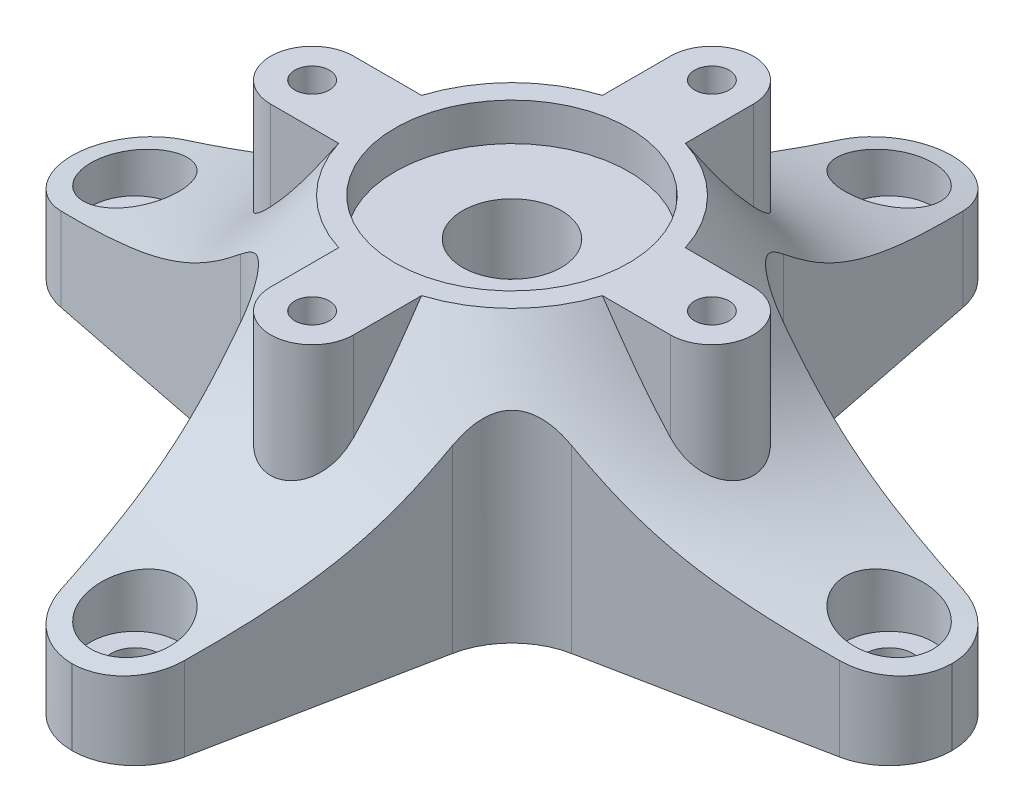
from build123d import *

# Parameters (mm, degrees)
SKETCH2_R                    = 27.94
SKETCH1_R                    = 88.9
CUT_EXTRUDE1_DEPTH           = 132.187065933
FILLET1_R                    = 15.24
BOSS_EXTRUDE1_START          = 15.24
BOSS_EXTRUDE1_DEPTH          = 15.24
BOSS_EXTRUDE2_START          = -24.628436
SKETCH11_R                   = 23.8125
BOSS_EXTRUDE2_DEPTH          = 24.628436
SKETCH12_R                   = 23.622
CUT_EXTRUDE3_DEPTH           = 7.62
SKETCH13_R                   = 22.5425
SKETCH13_R_2                 = 17.4625
BOSS_EXTRUDE3_DEPTH          = 7.62
SKETCH14_R                   = 9.9695
CUT_EXTRUDE4_DEPTH           = 13.97
SKETCH15_R                   = 7.366
CUT_EXTRUDE5_DEPTH           = 13.97
SKETCH17_R                   = 9.9695
SKETCH16_R                   = 7.366
U_0_368_DIAMETER_HOLE2_D     = 6.985
U_0_368_DIAMETER_HOLE2_DEPTH = 25.4
U_0_368_DIAMETER_HOLE2_TIP   = 2.098505712
SKETCH27_R                   = 4.826
CUT_EXTRUDE6_DEPTH           = 137.32401502
CUT_EXTRUDE7_START           = -44.45
CUT_EXTRUDE7_OUTLINE_R       = 8.89
CUT_EXTRUDE7_OUTLINE_R_2     = 4.826
CUT_EXTRUDE7_DEPTH           = 11.491512278
CIRPATTERN1_COUNT            = 4


# Read off the part's stored shape, not the designer's step: Cut-Extrude7
with BuildPart() as part:
    # Sketch2 → Loft1 section 0
    with BuildSketch(Plane(origin=(0, 37.465, 0), x_dir=(1, 0, 0), z_dir=(0, 1, 0))):
        Circle(SKETCH2_R)
    # Sketch1 → Loft1 section 1
    with BuildSketch(Plane(origin=(0, 0, 0), x_dir=(1, 0, 0), z_dir=(0, 1, 0))):
        Circle(SKETCH1_R)
    loft()

    # Sketch4 → Cut-Revolve1 (revolve, cut)
    with BuildSketch(Plane.XY):
        with BuildLine():
            Line((27.94, 37.465), (88.9, 0))
            add(Edge.make_bspline(
                [(27.94, 37.465), (44.244603089, 12.498594915), (51.492919323, 6.107575084), (88.9, 0)],
                knots=[0, 0, 0, 0, 1, 1, 1, 1], degree=3))
        make_face()
    revolve(axis=Axis((0, 0, 0), (0, 1, 0)), mode=Mode.SUBTRACT)

    # Sketch5 → Cut-Extrude1 (cut, through all)
    with BuildSketch(Plane.XZ):
        with BuildLine():
            Line((78.673834774, -12.456807136), (23.426780231, -23.426780231))
            Line((23.426780231, -23.426780231), (12.456807136, -78.673834774))
            ThreePointArc((12.456807136, -78.673834774), (8.099631088, -85.982305442), (0.106749312, -88.899935909))
            ThreePointArc((0.106749312, -88.899935909), (62.861792847, -62.861792847), (88.899935909, -0.106749312))
            ThreePointArc((88.899935909, -0.106749312), (85.982305442, -8.099631088), (78.673834774, -12.456807136))
        make_face()
        with BuildLine():
            ThreePointArc((-88.899935909, -0.106749312), (-62.861792847, -62.861792847), (-0.106749312, -88.899935909))
            ThreePointArc((-0.106749312, -88.899935909), (-8.099631088, -85.982305442), (-12.456807136, -78.673834774))
            Line((-12.456807136, -78.673834774), (-23.426780231, -23.426780231))
            Line((-23.426780231, -23.426780231), (-78.673834774, -12.456807136))
            ThreePointArc((-78.673834774, -12.456807136), (-85.982305442, -8.099631088), (-88.899935909, -0.106749312))
        make_face()
        with BuildLine():
            ThreePointArc((-12.456807136, 78.673834774), (-8.099631088, 85.982305442), (-0.106749312, 88.899935909))
            ThreePointArc((-0.106749312, 88.899935909), (-62.861792847, 62.861792847), (-88.899935909, 0.106749312))
            ThreePointArc((-88.899935909, 0.106749312), (-85.982305442, 8.099631088), (-78.673834774, 12.456807136))
            Line((-78.673834774, 12.456807136), (-23.426780231, 23.426780231))
            Line((-23.426780231, 23.426780231), (-12.456807136, 78.673834774))
        make_face()
        with BuildLine():
            ThreePointArc((78.673834774, 12.456807136), (85.982305442, 8.099631088), (88.899935909, 0.106749312))
            ThreePointArc((88.899935909, 0.106749312), (62.861792847, 62.861792847), (0.106749312, 88.899935909))
            ThreePointArc((0.106749312, 88.899935909), (8.099631088, 85.982305442), (12.456807136, 78.673834774))
            Line((12.456807136, 78.673834774), (23.426780231, 23.426780231))
            Line((23.426780231, 23.426780231), (78.673834774, 12.456807136))
        make_face()
    extrude(amount=-CUT_EXTRUDE1_DEPTH, mode=Mode.SUBTRACT)

    # Fillet1
    fillet1_edges = [part.edges().sort_by_distance(p)[0] for p in [
        (23.426780231, 14.876350489, -23.426780231),
        (-23.426780231, 14.876350489, -23.426780231),
        (-23.426780231, 14.876350489, 23.426780231),
        (23.426780231, 14.876350489, 23.426780231),
    ]]
    fillet(fillet1_edges, radius=FILLET1_R)

    # Sketch6 → Boss-Extrude1 (add)
    with BuildSketch(Plane.XZ.offset(BOSS_EXTRUDE1_START)):
        with BuildLine():
            Line((78.673834774, 12.456807136), (33.422113766, 21.442085465))
            ThreePointArc((33.422113766, 21.442085465), (25.613946683, 25.613946683), (21.442085465, 33.422113766))
            Line((21.442085465, 33.422113766), (12.456807136, 78.673834774))
            ThreePointArc((12.456807136, 78.673834774), (8.099631088, 85.982305442), (0.106749312, 88.899935909))
            ThreePointArc((0.106749312, 88.899935909), (0, 88.9), (-0.106749312, 88.899935909))
            ThreePointArc((-0.106749312, 88.899935909), (-8.099631088, 85.982305442), (-12.456807136, 78.673834774))
            Line((-12.456807136, 78.673834774), (-21.442085465, 33.422113766))
            ThreePointArc((-21.442085465, 33.422113766), (-25.613946683, 25.613946683), (-33.422113766, 21.442085465))
            Line((-33.422113766, 21.442085465), (-78.673834774, 12.456807136))
            ThreePointArc((-78.673834774, 12.456807136), (-85.98229269, 8.099646489), (-88.899935501, 0.106789299))
            ThreePointArc((-88.899935501, 0.106789299), (-88.89999964, 1.9994e-05), (-88.899935693, -0.106749312))
            ThreePointArc((-88.899935693, -0.106749312), (-85.982305275, -8.099630951), (-78.673834774, -12.456807136))
            Line((-78.673834774, -12.456807136), (-33.422113766, -21.442085465))
            ThreePointArc((-33.422113766, -21.442085465), (-25.613946683, -25.613946683), (-21.442085465, -33.422113766))
            Line((-21.442085465, -33.422113766), (-12.456807136, -78.673834774))
            ThreePointArc((-12.456807136, -78.673834774), (-8.099644999, -85.982293924), (-0.106785431, -88.89993554))
            ThreePointArc((-0.106785431, -88.89993554), (-1.806e-05, -88.899999675), (0.106749312, -88.899935714))
            ThreePointArc((0.106749312, -88.899935714), (8.099630964, -85.982305291), (12.456807136, -78.673834774))
            Line((12.456807136, -78.673834774), (21.442085465, -33.422113766))
            ThreePointArc((21.442085465, -33.422113766), (25.613946683, -25.613946683), (33.422113766, -21.442085465))
            Line((33.422113766, -21.442085465), (78.673834774, -12.456807136))
            ThreePointArc((78.673834774, -12.456807136), (85.98229269, -8.099646488), (88.899935501, -0.106789299))
            ThreePointArc((88.899935501, -0.106789299), (88.89999964, -1.9994e-05), (88.899935693, 0.106749312))
            ThreePointArc((88.899935693, 0.106749312), (85.982305275, 8.099630951), (78.673834774, 12.456807136))
        make_face()
    extrude(amount=-BOSS_EXTRUDE1_DEPTH)

    # Sketch11 → Boss-Extrude2 (add)
    with BuildSketch(Plane(origin=(0, 37.465, 0), x_dir=(1, 0, 0), z_dir=(0, 1, 0)).offset(BOSS_EXTRUDE2_START)):
        with BuildLine():
            Line((40.386, 8.382), (26.653061288, 8.382))
            ThreePointArc((26.653061288, 8.382), (19.756563466, 19.756563466), (8.382, 26.653061288))
            Line((8.382, 26.653061288), (8.382, 40.386))
            ThreePointArc((8.382, 40.386), (0, 48.768), (-8.382, 40.386))
            Line((-8.382, 40.386), (-8.382, 26.653061288))
            ThreePointArc((-8.382, 26.653061288), (-19.756563466, 19.756563466), (-26.653061288, 8.382))
            Line((-26.653061288, 8.382), (-40.386, 8.382))
            ThreePointArc((-40.386, 8.382), (-48.768, 0), (-40.386, -8.382))
            Line((-40.386, -8.382), (-26.653061288, -8.382))
            ThreePointArc((-26.653061288, -8.382), (-19.756563466, -19.756563466), (-8.382, -26.653061288))
            Line((-8.382, -26.653061288), (-8.382, -40.386))
            ThreePointArc((-8.382, -40.386), (0, -48.768), (8.382, -40.386))
            Line((8.382, -40.386), (8.382, -26.653061288))
            ThreePointArc((8.382, -26.653061288), (19.756563466, -19.756563466), (26.653061288, -8.382))
            Line((26.653061288, -8.382), (40.386, -8.382))
            ThreePointArc((40.386, -8.382), (48.768, 0), (40.386, 8.382))
        make_face()
        Circle(SKETCH11_R, mode=Mode.SUBTRACT)
    extrude(amount=BOSS_EXTRUDE2_DEPTH)

    # Sketch12 → Cut-Extrude3 (cut)
    with BuildSketch(Plane(origin=(0, 37.465, 0), x_dir=(1, 0, 0), z_dir=(0, 1, 0))):
        with Locations(Location((0, 0, 0), (0, 0, 270))):
            Circle(SKETCH12_R)
    extrude(amount=-CUT_EXTRUDE3_DEPTH, mode=Mode.SUBTRACT)

    # Sketch13 → Boss-Extrude3 (add)
    with BuildSketch(Plane.XZ.offset(15.24)):
        with Locations(Location((0, 0, 0), (0, 0, 90))):
            Circle(SKETCH13_R)
        with Locations(Location((0, 0, 0), (0, 0, 90))):
            Circle(SKETCH13_R_2, mode=Mode.SUBTRACT)
    extrude(amount=BOSS_EXTRUDE3_DEPTH)

    # Sketch14 → Cut-Extrude4 (cut)
    with BuildSketch(Plane(origin=(0, 29.845, 0), x_dir=(1, 0, 0), z_dir=(0, 1, 0))):
        with Locations(Location((0, 0, 0), (0, 0, 270))):
            Circle(SKETCH14_R)
    extrude(amount=-CUT_EXTRUDE4_DEPTH, mode=Mode.SUBTRACT)

    # Sketch15 → Cut-Extrude5 (cut)
    with BuildSketch(Plane.XZ.offset(15.24)):
        with Locations(Location((0, 0, 0), (0, 0, 270))):
            Circle(SKETCH15_R)
    extrude(amount=-CUT_EXTRUDE5_DEPTH, mode=Mode.SUBTRACT)

    # Sketch17 → Cut-Loft1 section 0
    with BuildSketch(Plane(origin=(0, 15.875, 0), x_dir=(1, 0, 0), z_dir=(0, 1, 0))):
        Circle(SKETCH17_R)
    # Sketch16 → Cut-Loft1 section 1
    with BuildSketch(Plane.XZ.offset(1.27)):
        Circle(SKETCH16_R)
    loft(mode=Mode.SUBTRACT)

    # U (0.368) Diameter Hole2
    with Locations(Plane(origin=(0, 37.465, 0), x_dir=(1, 0, 0), z_dir=(0, 1, 0))):
        with Locations((0, 40.386), (40.386, 0), (0, -40.386), (-40.386, 0)):
            Hole(U_0_368_DIAMETER_HOLE2_D / 2, depth=U_0_368_DIAMETER_HOLE2_DEPTH)
            with Locations((0, 0, -(U_0_368_DIAMETER_HOLE2_DEPTH + U_0_368_DIAMETER_HOLE2_TIP / 2))):  # 118° drill point
                Cone(0, U_0_368_DIAMETER_HOLE2_D / 2, U_0_368_DIAMETER_HOLE2_TIP, mode=Mode.SUBTRACT)

    # Sketch27 → Cut-Extrude6 (cut, through all)
    with BuildSketch(Plane(origin=(0, -15.24, 0), x_dir=(-1, 0, 0), z_dir=(0, -1, 0))):
        with Locations(Location((0, 76.200384555, 0), (0, 0, 90))):
            Circle(SKETCH27_R)
    cut_extrude6 = extrude(amount=-CUT_EXTRUDE6_DEPTH, mode=Mode.SUBTRACT)

    # Cut-Extrude7 outline → Cut-Extrude7 (cut)
    with BuildSketch(Plane(origin=(0, 37.465, 0), x_dir=(1, 0, 0), z_dir=(0, 1, 0)).offset(CUT_EXTRUDE7_START)):
        with Locations((0, 76.200384555)):
            Circle(CUT_EXTRUDE7_OUTLINE_R)
        with Locations((0, 76.200384555)):
            Circle(CUT_EXTRUDE7_OUTLINE_R_2, mode=Mode.SUBTRACT)
    cut_extrude7 = extrude(amount=CUT_EXTRUDE7_DEPTH, mode=Mode.SUBTRACT)

    # CirPattern1: Cut-Extrude6, Cut-Extrude7 ×4 about axis
    cirpattern1_axis = Axis((0, 0, 0), (0, 1, 0))
    add([cut_extrude6.rotate(cirpattern1_axis, i * 360 / CIRPATTERN1_COUNT) for i in range(1, CIRPATTERN1_COUNT)], mode=Mode.SUBTRACT)
    add([cut_extrude7.rotate(cirpattern1_axis, i * 360 / CIRPATTERN1_COUNT) for i in range(1, CIRPATTERN1_COUNT)], mode=Mode.SUBTRACT)


solid = part.part
